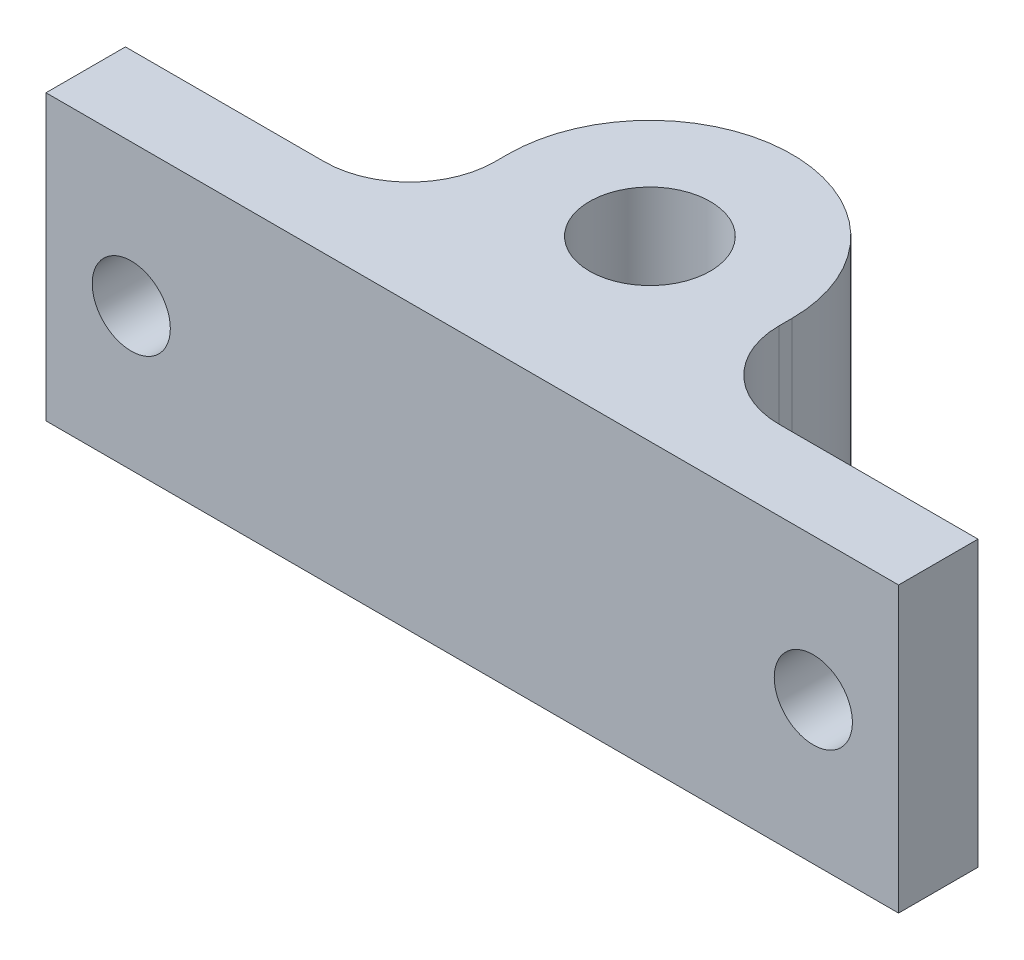
from build123d import *

# Parameters (mm, degrees)
SKETCH1_R           = 4.25
BOSS_EXTRUDE1_DEPTH = 20
SKETCH2_R           = 2.75
CUT_EXTRUDE1_DEPTH  = 40.823808898


with BuildPart() as part:
    # Sketch1 → Boss-Extrude1 (new body)
    with BuildSketch(Plane(origin=(0, 0, 0), x_dir=(1, 0, 0), z_dir=(0, 1, 0))):
        with BuildLine():
            Line((30, -12.5), (-30, -12.5))
            Line((-30, -12.5), (-30, -6.90963498))
            Line((-30, -6.90963498), (-16, -6.90963498))
            ThreePointArc((-16, -6.90963498), (-11.757359313, -5.152275667), (-10, -0.90963498))
            Line((-10, -0.90963498), (-10, 0))
            ThreePointArc((-10, 0), (0, 10), (10, 0))
            Line((10, 0), (10, -0.90963498))
            ThreePointArc((10, -0.90963498), (11.757359313, -5.152275667), (16, -6.90963498))
            Line((16, -6.90963498), (30, -6.90963498))
            Line((30, -6.90963498), (30, -12.5))
        make_face()
        Circle(SKETCH1_R, mode=Mode.SUBTRACT)
    extrude(amount=BOSS_EXTRUDE1_DEPTH)

    # Sketch2 → Cut-Extrude1 (cut, through all)
    with BuildSketch(Plane(origin=(0, 0, 6.90963498), x_dir=(-1, 0, 0), z_dir=(0, 0, -1))):
        with Locations((-24, 10)):
            Circle(SKETCH2_R)
        with Locations((24, 10)):
            Circle(SKETCH2_R)
    extrude(amount=-CUT_EXTRUDE1_DEPTH, mode=Mode.SUBTRACT)


solid = part.part
